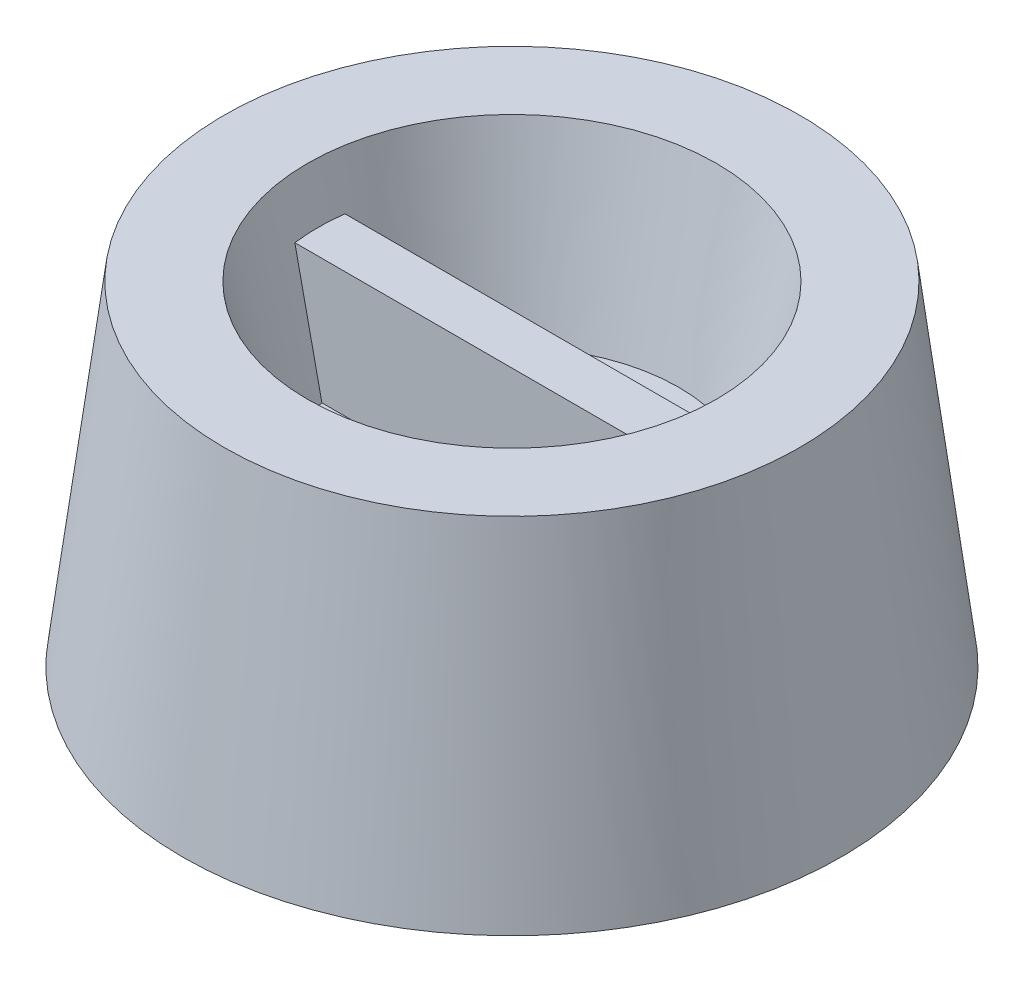
from build123d import *

# Parameters (mm, degrees)
SKETCH1_R           = 7.9
SKETCH2_R           = 6.9
SKETCH4_R           = 4
SKETCH3_R           = 4.9
SKETCH7_W           = 12
SKETCH7_H           = 1.2
BOSS_EXTRUDE2_DEPTH = 3
SKETCH8_R           = 4.970098948
SKETCH8_R_2         = 3.95
BOSS_EXTRUDE3_DEPTH = 2.6
CHAMFER1_SIZE       = 0.436764281
CHAMFER1_SIZE_2     = 1.2


# Read off the part's stored shape, not the designer's step: Shell1
with BuildPart() as part:
    # Sketch1 → Loft1 section 0
    with BuildSketch(Plane(origin=(0, 0, 0), x_dir=(1, 0, 0), z_dir=(0, 1, 0))):
        Circle(SKETCH1_R)
    # Sketch2 → Loft1 section 1
    with BuildSketch(Plane(origin=(0, 8, 0), x_dir=(1, 0, 0), z_dir=(0, 1, 0))):
        Circle(SKETCH2_R)
    loft()

    # Sketch4 → Cut-Loft2 section 0
    with BuildSketch(Plane(origin=(0, 3.8, 0), x_dir=(1, 0, 0), z_dir=(0, 1, 0))):
        Circle(SKETCH4_R)
    # Sketch3 → Cut-Loft2 section 1
    with BuildSketch(Plane(origin=(0, 8, 0), x_dir=(1, 0, 0), z_dir=(0, 1, 0))):
        Circle(SKETCH3_R)
    loft(mode=Mode.SUBTRACT)

    # Sketch7 → Boss-Extrude2 (add)
    with BuildSketch(Plane(origin=(0, 6.8, 0), x_dir=(1, 0, 0), z_dir=(0, 1, 0))):
        Rectangle(SKETCH7_W, SKETCH7_H)
    extrude(amount=-BOSS_EXTRUDE2_DEPTH)

    # Shell1 outline → Shell1 (revolve, cut)
    with BuildSketch(Plane.XY):
        Polygon((5.851506773, 6.713236516), (4.970098948, 2.6), (0, 2.6), (0, 0), (6.690661338, 0), align=None)
    revolve(axis=Axis((0, 0, 0), (0, 1, 0)), mode=Mode.SUBTRACT)

    # Sketch8 → Boss-Extrude3 (add)
    with BuildSketch(Plane.XZ.offset(-2.6)):
        with Locations(Location((0, 0, 0), (0, 0, 90))):
            Circle(SKETCH8_R)
        with Locations(Location((0, 0, 0), (0, 0, 90))):
            Circle(SKETCH8_R_2, mode=Mode.SUBTRACT)
    extrude(amount=BOSS_EXTRUDE3_DEPTH)

    # Chamfer1
    # the kernel refuses this chamfer: 1.2, 0.436764281 mm, written as the material it takes off along each edge
    with BuildSketch(Plane(origin=(0, 0, 0), x_dir=(0, 0, 1), z_dir=(1, 0, 0))) as chamfer1_piece_1:
        Polygon((4.970098948, -CHAMFER1_SIZE), (4.970098948 - CHAMFER1_SIZE_2, 0), (4.970098948, 0), align=None)
    revolve(axis=Axis((0, 0, 0), (0, -1, 0)), mode=Mode.SUBTRACT)


solid = part.part
